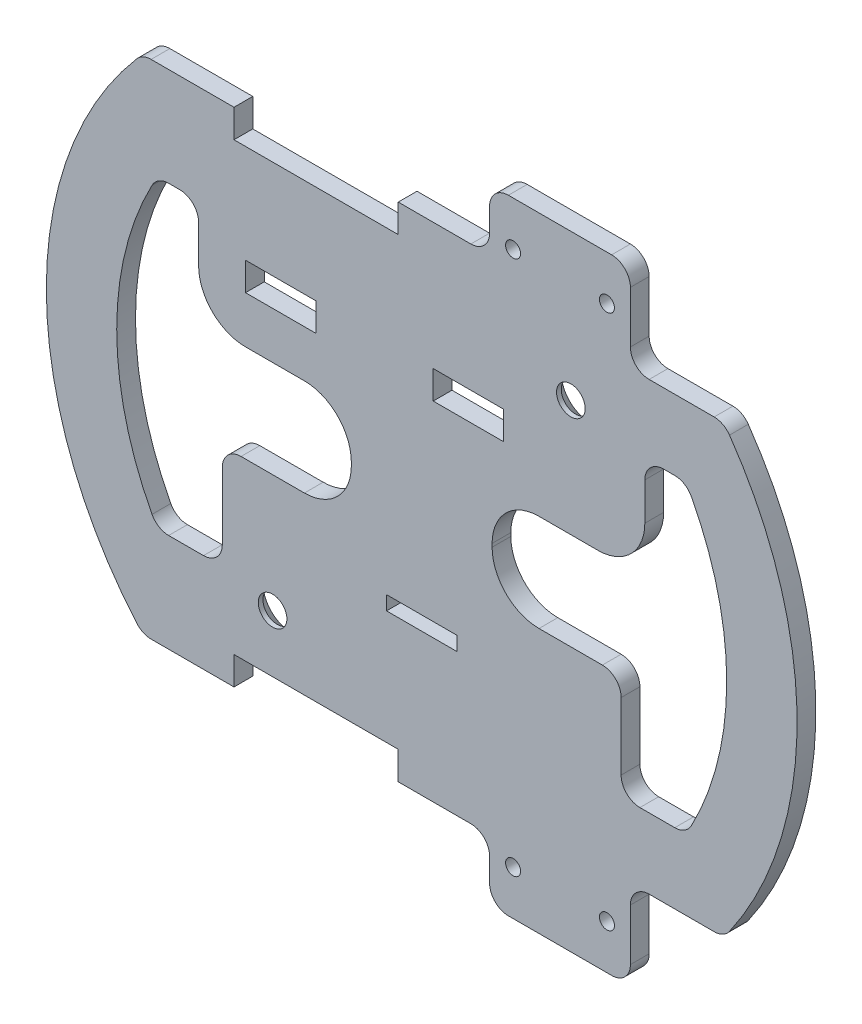
from build123d import *

# Parameters (mm, degrees)
ESBO_O1_R                = 3.05
ESBO_O1_W                = 15
ESBO_O1_H                = 3
ESBO_O1_R_2              = 1.6
ESBO_O1_H_2              = 6
RESSALTO_EXTRUS_O1_DEPTH = 4
CHANFRO1_SIZE            = 3
FILETE1_R                = 4
FILETE2_R                = 10


with BuildPart() as part:
    # Esboço1 → Ressalto-extrusão1 (new body)
    with BuildSketch(Plane.XY):
        with BuildLine():
            Line((14.471901241, -53.5), (14.471901241, -66.5))
            Line((14.471901241, -66.5), (44.471901241, -66.5))
            Line((44.471901241, -66.5), (44.471901241, -47.5))
            Line((44.471901241, -47.5), (64.371965948, -47.5))
            ThreePointArc((64.371965948, -47.5), (75.99262226, -25.002427124), (80, 0))
            ThreePointArc((80, 0), (75.99262226, 25.002427124), (64.371965948, 47.5))
            Line((64.371965948, 47.5), (44.471901241, 47.5))
            Line((44.471901241, 47.5), (44.471901241, 66.5))
            Line((44.471901241, 66.5), (14.471901241, 66.5))
            Line((14.471901241, 66.5), (14.471901241, 53.5))
            Line((14.471901241, 53.5), (-5.003543323, 53.5))
            Line((-5.003543323, 53.5), (-5.003543323, 47.5))
            Line((-5.003543323, 47.5), (-40.003543323, 47.5))
            Line((-40.003543323, 47.5), (-40.003543323, 53.5))
            Line((-40.003543323, 53.5), (-59.478987886, 53.5))
            ThreePointArc((-59.478987886, 53.5), (-74.693771597, 28.650313865), (-80, 0))
            ThreePointArc((-80, 0), (-74.693771597, -28.650313865), (-59.478987886, -53.5))
            Line((-59.478987886, -53.5), (-40.003543323, -53.5))
            Line((-40.003543323, -53.5), (-40.003543323, -47.5))
            Line((-40.003543323, -47.5), (-5.003543323, -47.5))
            Line((-5.003543323, -47.5), (-5.003543323, -53.5))
            Line((-5.003543323, -53.5), (14.471901241, -53.5))
        make_face()
        with BuildLine():
            ThreePointArc((-56.291651246, -32.5), (-65, 0), (-56.291651246, 32.5))
            Line((-56.291651246, 32.5), (-47.55, 32.5))
            Line((-47.55, 32.5), (-47.55, 10.5))
            Line((-47.55, 10.5), (-15, 10.5))
            Line((-15, 10.5), (-15, -10.2))
            Line((-15, -10.2), (-42.5, -10.2))
            Line((-42.5, -10.2), (-42.5, -32.5))
            Line((-42.5, -32.5), (-56.291651246, -32.5))
        make_face(mode=Mode.SUBTRACT)
        with Locations((-31.783703802, -35.29937921)):
            Circle(ESBO_O1_R, mode=Mode.SUBTRACT)
        with Locations((0, -21.7)):
            Rectangle(ESBO_O1_W, ESBO_O1_H, mode=Mode.SUBTRACT)
        with Locations((19.471901241, -57)):
            Circle(ESBO_O1_R_2, mode=Mode.SUBTRACT)
        with Locations((39.471901241, -57)):
            Circle(ESBO_O1_R_2, mode=Mode.SUBTRACT)
        with BuildLine():
            Line((42.5, -10.2), (15, -10.2))
            Line((15, -10.2), (15, 10.5))
            Line((15, 10.5), (47.55, 10.5))
            Line((47.55, 10.5), (47.55, 32.5))
            Line((47.55, 32.5), (56.291651246, 32.5))
            ThreePointArc((56.291651246, 32.5), (65, 0), (56.291651246, -32.5))
            Line((56.291651246, -32.5), (42.5, -32.5))
            Line((42.5, -32.5), (42.5, -10.2))
        make_face(mode=Mode.SUBTRACT)
        with Locations((-30.05, 23.5)):
            Rectangle(ESBO_O1_W, ESBO_O1_H_2, mode=Mode.SUBTRACT)
        with Locations((9.95, 23.5)):
            Rectangle(ESBO_O1_W, ESBO_O1_H_2, mode=Mode.SUBTRACT)
        with Locations((31.783703802, 35.29937921)):
            Circle(ESBO_O1_R, mode=Mode.SUBTRACT)
        with Locations((19.471901241, 57)):
            Circle(ESBO_O1_R_2, mode=Mode.SUBTRACT)
        with Locations((39.471901241, 57)):
            Circle(ESBO_O1_R_2, mode=Mode.SUBTRACT)
    extrude(amount=RESSALTO_EXTRUS_O1_DEPTH)

    # Chanfro1
    chanfro1_edges = [part.edges().sort_by_distance(p)[0] for p in [
        (28.733703802, 35.29937921, 0),
        (-34.833703802, -35.29937921, 0),
    ]]
    chamfer(chanfro1_edges, length=CHANFRO1_SIZE)

    # Filete1
    filete1_edges = [part.edges().sort_by_distance(p)[0] for p in [
        (56.291651246, 32.5, 2),
        (47.55, 32.5, 2),
        (42.5, -32.5, 2),
        (56.291651246, -32.5, 2),
        (-42.5, -32.5, 2),
        (-56.291651246, -32.5, 2),
        (42.5, -10.2, 2),
        (-42.5, -10.2, 2),
        (-47.55, 32.5, 2),
        (-56.291651246, 32.5, 2),
        (14.471901241, -53.5, 2),
        (14.471901241, 53.5, 2),
        (44.471901241, 47.5, 2),
        (44.471901241, -47.5, 2),
        (14.471901241, 66.5, 2),
        (44.471901241, 66.5, 2),
        (44.471901241, -66.5, 2),
        (14.471901241, -66.5, 2),
        (-59.478987886, 53.5, 2),
        (64.371965948, 47.5, 2),
        (64.371965948, -47.5, 2),
        (-59.478987886, -53.5, 2),
    ]]
    fillet(filete1_edges, radius=FILETE1_R)

    # Filete2
    filete2_edges = [part.edges().sort_by_distance(p)[0] for p in [
        (15, -10.2, 2),
        (-15, -10.2, 2),
        (-15, 10.5, 2),
        (15, 10.5, 2),
        (47.55, 10.5, 2),
        (-47.55, 10.5, 2),
    ]]
    fillet(filete2_edges, radius=FILETE2_R)


solid = part.part
